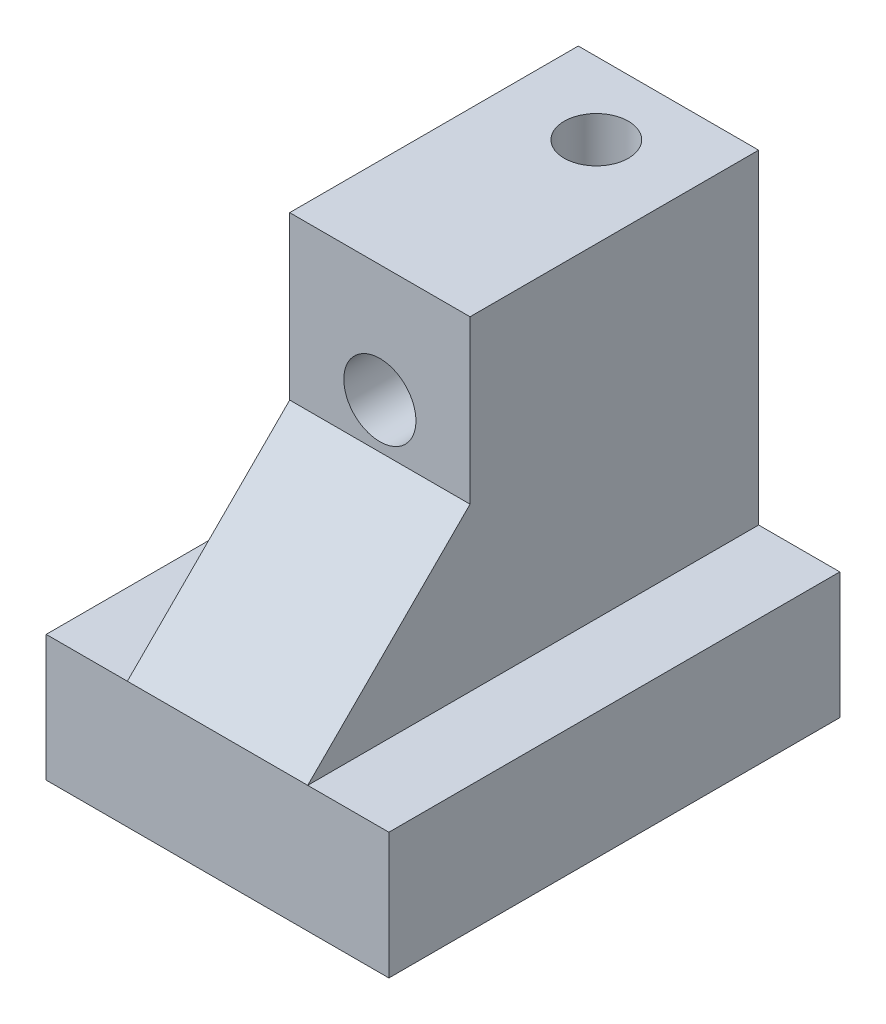
from build123d import *

# Parameters (mm, degrees)
SKETCH1_W                  = 12.065
SKETCH1_H                  = 4.445
BASE_DEPTH                 = 15.875
SKETCH7_W                  = 6.35
SKETCH7_H                  = 10.16
BOSS_EXTRUDE1_DEPTH        = 11.43
SKETCH3_R                  = 1.27
SHAFTHOLE_DEPTH            = 22.78984712
F_4_40_TAPPED_HOLE1_REACH  = 25.247
F_4_40_TAPPED_HOLE1_BORE_R = 1.1303
CHAMFER1_SIZE              = 5.715


with BuildPart() as part:
    # Sketch1 → Base (new body)
    with BuildSketch(Plane.XY):
        Rectangle(SKETCH1_W, SKETCH1_H)
    extrude(amount=BASE_DEPTH)

    # Sketch7 → Boss-Extrude1 (add)
    with BuildSketch(Plane(origin=(0, 2.2225, 0), x_dir=(1, 0, 0), z_dir=(0, 1, 0))):
        with Locations((0, -5.08)):
            Rectangle(SKETCH7_W, SKETCH7_H)
    extrude(amount=BOSS_EXTRUDE1_DEPTH)

    # Sketch3 → ShaftHole (cut, through all)
    with BuildSketch(Plane(origin=(0, 0, 0), x_dir=(-1, 0, 0), z_dir=(0, 0, -1))):
        with Locations((0, 9.525)):
            Circle(SKETCH3_R)
    extrude(amount=-SHAFTHOLE_DEPTH, mode=Mode.SUBTRACT)

    # #4-40 Tapped Hole1 bore → #4-40 Tapped Hole1 (cut, up to next)
    with BuildSketch(Plane(origin=(0, 13.6525, 0), x_dir=(1, 0, 0), z_dir=(0, 1, 0)), mode=Mode.PRIVATE) as f_4_40_tapped_hole1_sk1:
        with Locations((0, -2.54)):
            Circle(F_4_40_TAPPED_HOLE1_BORE_R)
    f_4_40_tapped_hole1_tool1 = extrude(f_4_40_tapped_hole1_sk1.sketch, amount=-F_4_40_TAPPED_HOLE1_REACH, mode=Mode.PRIVATE) & part.part
    add(f_4_40_tapped_hole1_tool1.solids().sort_by_distance((0, 13.6525, 2.54))[0], mode=Mode.SUBTRACT)

    # Chamfer1
    chamfer1_edges = [part.edges().sort_by_distance(p)[0] for p in [
        (0, 2.2225, 10.16),
    ]]
    chamfer(chamfer1_edges, length=CHAMFER1_SIZE - 0.0001)  # a hair under: the kernel refuses the full size


solid = part.part
